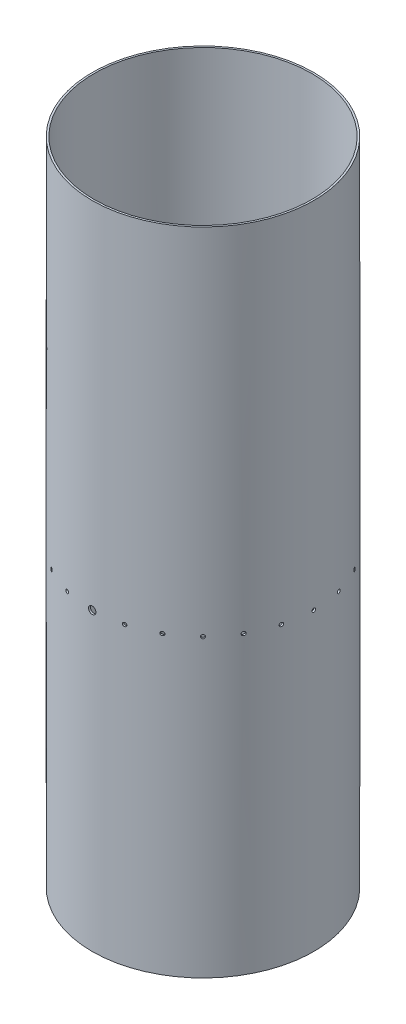
from build123d import *

# Parameters (mm, degrees)
SKETCH1_R               = 95.25
SKETCH1_R_2             = 93.6625
BOSS_EXTRUDE1_DEPTH     = 558.8
SKETCH10_R              = 1.5875
CUT_EXTRUDE1_DEPTH      = 597.021161537
CIRPATTERN1_COUNT       = 24
CUT_EXTRUDE2_DEPTH      = 597.02116168
CUT_EXTRUDE2_DEPTH_BACK = 597.02116168
SKETCH12_R              = 3.175
CUT_EXTRUDE5_DEPTH      = 575.806545848
CUT_EXTRUDE5_DEPTH_BACK = 575.806545848
SKETCH16_R              = 2.0955


with BuildPart() as part:
    # Sketch1 → Boss-Extrude1 (new body)
    with BuildSketch(Plane(origin=(0, 0, 0), x_dir=(1, 0, 0), z_dir=(0, 1, 0))):
        Circle(SKETCH1_R)
        Circle(SKETCH1_R_2, mode=Mode.SUBTRACT)
    extrude(amount=BOSS_EXTRUDE1_DEPTH)

    # Sketch10 → Cut-Extrude1 (cut, through all)
    with BuildSketch(Plane.XY.offset(88.9)):
        with Locations((0, 254)):
            Circle(SKETCH10_R)
    cut_extrude1 = extrude(amount=-CUT_EXTRUDE1_DEPTH, mode=Mode.SUBTRACT)

    # CirPattern1: Cut-Extrude1 ×24 about axis
    cirpattern1_axis = Axis((0, 558.8, 0), (0, -1, 0))
    for i in range(1, CIRPATTERN1_COUNT):
        add(cut_extrude1.rotate(cirpattern1_axis, i * 360 / CIRPATTERN1_COUNT), mode=Mode.SUBTRACT)

    # Sketch12 → Cut-Extrude2 (cut, two sides: drawn at the far end of the back side and taken through both)
    with BuildSketch(Plane.XY.offset(88.9).offset(-CUT_EXTRUDE2_DEPTH_BACK)):
        with Locations((0, 254)):
            Circle(SKETCH12_R)
    extrude(amount=CUT_EXTRUDE2_DEPTH + CUT_EXTRUDE2_DEPTH_BACK, mode=Mode.SUBTRACT)

    # Sketch16 → Cut-Extrude5 (cut, two sides: drawn at the far end of the back side and taken through both)
    with BuildSketch(Plane.XY.offset(-CUT_EXTRUDE5_DEPTH_BACK)):
        with Locations((-63.5, 406.4)):
            Circle(SKETCH16_R)
    extrude(amount=CUT_EXTRUDE5_DEPTH + CUT_EXTRUDE5_DEPTH_BACK, mode=Mode.SUBTRACT)


solid = part.part
